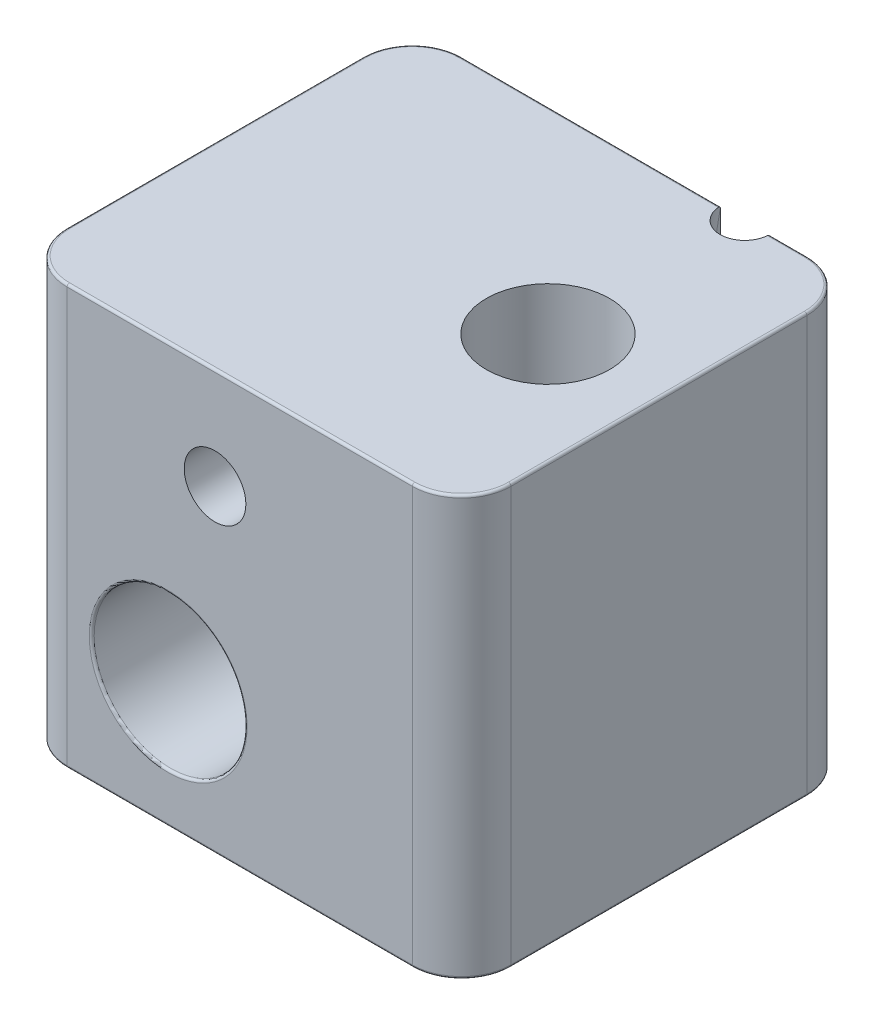
from build123d import *

# Parameters (mm, degrees)
BOSS_EXTRUDE1_DEPTH    = 17
M6_TAPPED_HOLE1_D      = 5
CUT_EXTRUDE1_REACH     = 27.02
SKETCH5_R              = 3.1
M3_TAPPED_HOLE1_REACH  = 28.019
M3_TAPPED_HOLE1_BORE_R = 1.25
M3_TAPPED_HOLE2_D      = 2.5
SKETCH13_R             = 1
CUT_EXTRUDE2_DEPTH     = 16.2
CUT_EXTRUDE3_START     = 3.5
CUT_EXTRUDE3_DEPTH     = 2
FILLET1_R              = 0.1


with BuildPart() as part:
    # Sketch1 → Boss-Extrude1 (new body)
    with BuildSketch(Plane(origin=(0, 0, 0), x_dir=(1, 0, 0), z_dir=(0, 1, 0))):
        with BuildLine():
            Line((-7, 8), (7, 8))
            ThreePointArc((7, 8), (8.414213562, 7.414213562), (9, 6))
            Line((9, 6), (9, -6))
            ThreePointArc((9, -6), (8.414213562, -7.414213562), (7, -8))
            Line((7, -8), (-7, -8))
            ThreePointArc((-7, -8), (-8.414213562, -7.414213562), (-9, -6))
            Line((-9, -6), (-9, 6))
            ThreePointArc((-9, 6), (-8.414213562, 7.414213562), (-7, 8))
        make_face()
    extrude(amount=BOSS_EXTRUDE1_DEPTH)

    # M6 Tapped Hole1 (through all)
    with Locations(Plane(origin=(0, 17, 0), x_dir=(1, 0, 0), z_dir=(0, 1, 0))):
        with Locations((4.5, 0)):
            Hole(M6_TAPPED_HOLE1_D / 2)

    # Sketch5 → Cut-Extrude1 (cut, up to next)
    with BuildSketch(Plane.XY.offset(8), mode=Mode.PRIVATE) as cut_extrude1_sk1:
        with Locations((-2.9, 5.1)):
            Circle(SKETCH5_R)
    cut_extrude1_tool1 = extrude(cut_extrude1_sk1.sketch, amount=-CUT_EXTRUDE1_REACH, mode=Mode.PRIVATE) & part.part
    add(cut_extrude1_tool1.solids().sort_by_distance((-2.9, 5.1, 8))[0], mode=Mode.SUBTRACT)

    # M3 Tapped Hole1 bore → M3 Tapped Hole1 (cut, up to next)
    with BuildSketch(Plane.ZY.offset(9), mode=Mode.PRIVATE) as m3_tapped_hole1_sk1:
        with Locations((0, 5.1)):
            Circle(M3_TAPPED_HOLE1_BORE_R)
    m3_tapped_hole1_tool1 = extrude(m3_tapped_hole1_sk1.sketch, amount=-M3_TAPPED_HOLE1_REACH, mode=Mode.PRIVATE) & part.part
    add(m3_tapped_hole1_tool1.solids().sort_by_distance((-9, 5.1, 0))[0], mode=Mode.SUBTRACT)

    # M3 Tapped Hole2 (through all)
    with Locations(Plane.XY.offset(8)):
        with Locations((-1, 12.9)):
            Hole(M3_TAPPED_HOLE2_D / 2)

    # Sketch13 → Cut-Extrude2 (cut)
    with BuildSketch(Plane(origin=(0, 17.880667156, -3.496925738), x_dir=(1, 0, 0), z_dir=(0, 0.9814078107791567, -0.19193412656863024))):
        with Locations(Location((4.5, 4.588382335, 0), (0, 0, 270))):
            Circle(SKETCH13_R)
    extrude(amount=-CUT_EXTRUDE2_DEPTH, mode=Mode.SUBTRACT)

    # Cut-Extrude3: read off the stored shape, not the designer's step
    # Cut-Extrude3 outline → Cut-Extrude3 (cut)
    with BuildSketch(Plane.YZ.offset(CUT_EXTRUDE3_START)):
        Polygon((17, -8), (11.8, -6.983034935), (11.8, -8), align=None)
    extrude(amount=CUT_EXTRUDE3_DEPTH, mode=Mode.SUBTRACT)

    # Fillet1
    fillet1_edges = [part.edges().sort_by_distance(p)[0] for p in [
        (8.414213562, 0, -7.414213562),
        (9, 0, 0),
        (8.414213562, 0, 7.414213562),
        (0, 0, 8),
        (-8.414213562, 0, 7.414213562),
        (-9, 0, 0),
        (-8.414213562, 0, -7.414213562),
        (6.25, 17, -8),
        (8.414213562, 17, -7.414213562),
        (9, 17, 0),
        (8.414213562, 17, 7.414213562),
        (0, 17, 8),
        (-8.414213562, 17, 7.414213562),
        (-9, 17, 0),
        (-8.414213562, 17, -7.414213562),
        (-6, 5.1, 8),
        (0, 0, -8),
        (-6, 5.1, -8),
        (-1.75, 17, -8),
    ]]
    fillet(fillet1_edges, radius=FILLET1_R)


solid = part.part
